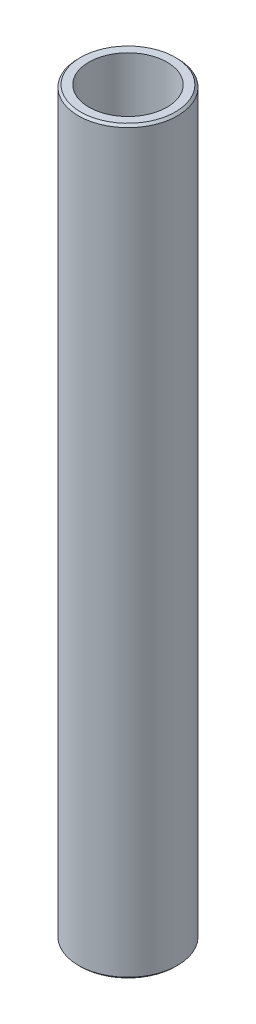
from build123d import *

# Parameters (mm, degrees)
SKETCH1_R           = 17.5
BOSS_EXTRUDE1_DEPTH = 261.349292026
SKETCH2_R           = 13.796851261
CUT_EXTRUDE1_DEPTH  = 263.518480192
CHAMFER1_SIZE       = 0.785713561


with BuildPart() as part:
    # Sketch1 → Boss-Extrude1 (new body)
    with BuildSketch(Plane(origin=(0, 0, 0), x_dir=(1, 0, 0), z_dir=(0, 1, 0))):
        Circle(SKETCH1_R)
    extrude(amount=BOSS_EXTRUDE1_DEPTH)

    # Sketch2 → Cut-Extrude1 (cut, through all)
    with BuildSketch(Plane(origin=(0, 0, 0), x_dir=(1, 0, 0), z_dir=(0, 1, 0))):
        Circle(SKETCH2_R)
    extrude(amount=CUT_EXTRUDE1_DEPTH, mode=Mode.SUBTRACT)

    # Chamfer1
    chamfer1_edges = [part.edges().sort_by_distance(p)[0] for p in [
        (-17.5, 261.349292026, 0),
        (-17.5, 0, 0),
    ]]
    chamfer(chamfer1_edges, length=CHAMFER1_SIZE)


solid = part.part
